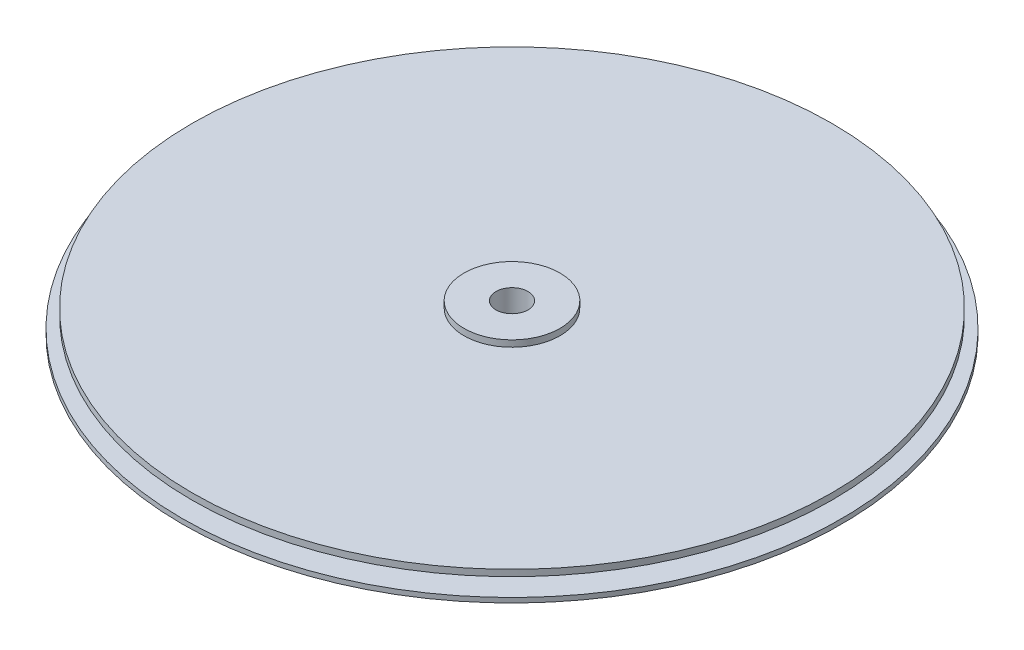
from build123d import *

# Parameters (mm, degrees)
SKICA2_R        = 100
SKICA2_R_2      = 8
VYSUNOUT1_DEPTH = 2
SKICA10_W       = 88
SKICA10_H       = 1.5


# Read off the part's stored shape, not the designer's step: Skica-pole2
with BuildPart() as part:
    # Skica1 → Rotovat1 (revolve)
    with BuildSketch(Plane.XY, mode=Mode.PRIVATE) as rotovat1_sk:
        Polygon((3.25, 0), (3.25, 2.2), (5, 2.2), (5, 12.2), (15, 12.2), (15, 10.2), (8, 10.2), (8, 8), (7, 8), (7, 2), (6.5, 2), (6.5, 1), (7, 1), (7, 0), align=None)
    revolve(rotovat1_sk.sketch.rotate(Axis((0, 0, 0), (0, 1, 0)), 90), axis=Axis((0, 0, 0), (0, 1, 0)))

    # Skica9 → Odebrat rotací1 (revolve, cut)
    with BuildSketch(Plane.XY, mode=Mode.PRIVATE) as odebrat_rotac_1_sk:
        Polygon((3.692820323, 7.2), (7, 7.2), (7, 6), (3, 6), align=None)
    revolve(odebrat_rotac_1_sk.sketch.rotate(Axis((0, 6, 0), (1, 0, 0)), 180), axis=Axis((0, 6, 0), (1, 0, 0)), mode=Mode.SUBTRACT)


with BuildPart() as body_2:
    # Skica2 → Vysunout1 (new body)
    with BuildSketch(Plane.XZ.offset(-10.2)):
        with Locations(Location((0, 0, 0), (0, 0, 270))):
            Circle(SKICA2_R)
        with Locations(Location((0, 0, 0), (0, 0, 270))):
            Circle(SKICA2_R_2, mode=Mode.SUBTRACT)
    extrude(amount=VYSUNOUT1_DEPTH)


with BuildPart() as body_3:
    # Skica4 → Rotovat2 (revolve)
    with BuildSketch(Plane.XY, mode=Mode.PRIVATE) as rotovat2_sk:
        with BuildLine():
            Line((7, 2), (9, 2))
            Line((9, 2), (9, 3.145950378))
            ThreePointArc((9, 3.145950378), (7.75, 5), (9, 6.854049622))
            Line((9, 6.854049622), (9, 8))
            Line((9, 8), (7, 8))
            Line((7, 8), (7, 2))
        make_face()
        with BuildLine():
            Line((12.5, 2), (12.5, 8))
            Line((12.5, 8), (10.5, 8))
            Line((10.5, 8), (10.5, 6.854049622))
            ThreePointArc((10.5, 6.854049622), (11.75, 5), (10.5, 3.145950378))
            Line((10.5, 3.145950378), (10.5, 2))
            Line((10.5, 2), (12.5, 2))
        make_face()
    revolve(rotovat2_sk.sketch.rotate(Axis((0, 0, 0), (0, 1, 0)), 90), axis=Axis((0, 0, 0), (0, 1, 0)))


with BuildPart() as body_4:
    # Skica-pole2 outline → Skica-pole2 (revolve)
    with BuildSketch(Plane.XY):
        with BuildLine():
            Line((9, 8), (7, 8))
            Line((7, 8), (7, 2))
            Line((7, 2), (9, 2))
            Line((9, 2), (9, 3.145950378))
            ThreePointArc((9, 3.145950378), (7.75, 5), (9, 6.854049622))
            Line((9, 6.854049622), (9, 8))
        make_face()
    revolve(axis=Axis((0, 0, 0), (0, 1, 0)))


with BuildPart() as body_5:
    # Skica-pole2 2 outline → Skica-pole2 2 (revolve)
    with BuildSketch(Plane.XY):
        with BuildLine():
            Line((12.5, 8), (10.5, 8))
            Line((10.5, 8), (10.5, 6.854049622))
            ThreePointArc((10.5, 6.854049622), (11.75, 5), (10.5, 3.145950378))
            Line((10.5, 3.145950378), (10.5, 2))
            Line((10.5, 2), (12.5, 2))
            Line((12.5, 2), (12.5, 8))
        make_face()
    revolve(axis=Axis((0, 0, 0), (0, 1, 0)))


with BuildPart() as body_6:
    # Skica-pole2 3 outline → Skica-pole2 3 (revolve)
    with BuildSketch(Plane.XY):
        with BuildLine():
            Line((12.5, 8), (10.5, 8))
            Line((10.5, 8), (10.5, 6.854049622))
            ThreePointArc((10.5, 6.854049622), (11.75, 5), (10.5, 3.145950378))
            Line((10.5, 3.145950378), (10.5, 2))
            Line((10.5, 2), (12.5, 2))
            Line((12.5, 2), (12.5, 8))
        make_face()
    revolve(axis=Axis((0, 0, 0), (0, 1, 0)))


with BuildPart() as body_7:
    # Skica-pole2 4 outline → Skica-pole2 4 (revolve)
    with BuildSketch(Plane.XY):
        with BuildLine():
            Line((9, 8), (7, 8))
            Line((7, 8), (7, 2))
            Line((7, 2), (9, 2))
            Line((9, 2), (9, 3.145950378))
            ThreePointArc((9, 3.145950378), (7.75, 5), (9, 6.854049622))
            Line((9, 6.854049622), (9, 8))
        make_face()
    revolve(axis=Axis((0, 0, 0), (0, 1, 0)))


with BuildPart() as body_8:
    # Skica8 → Rotovat3 (revolve)
    with BuildSketch(Plane.XY, mode=Mode.PRIVATE) as rotovat3_sk:
        Polygon((12.5, 6.7), (20, 6.7), (20, 4.7), (15, 4.7), (15, 1), (10, 1), (10, 2), (12.5, 2), align=None)
    revolve(rotovat3_sk.sketch.rotate(Axis((0, 0, 0), (0, 1, 0)), 90), axis=Axis((0, 0, 0), (0, 1, 0)))


with BuildPart() as body_9:
    # Skica10 → Rotovat4 (revolve)
    with BuildSketch(Plane.XY, mode=Mode.PRIVATE) as rotovat4_sk:
        with Locations((59, 3.95)):
            Rectangle(SKICA10_W, SKICA10_H)
    revolve(rotovat4_sk.sketch.rotate(Axis((0, 11.688049043, 0), (0, 1, 0)), 90), axis=Axis((0, 11.688049043, 0), (0, 1, 0)))


solid = Compound([part.part, body_2.part, body_3.part, body_4.part, body_5.part, body_6.part, body_7.part, body_8.part, body_9.part])
